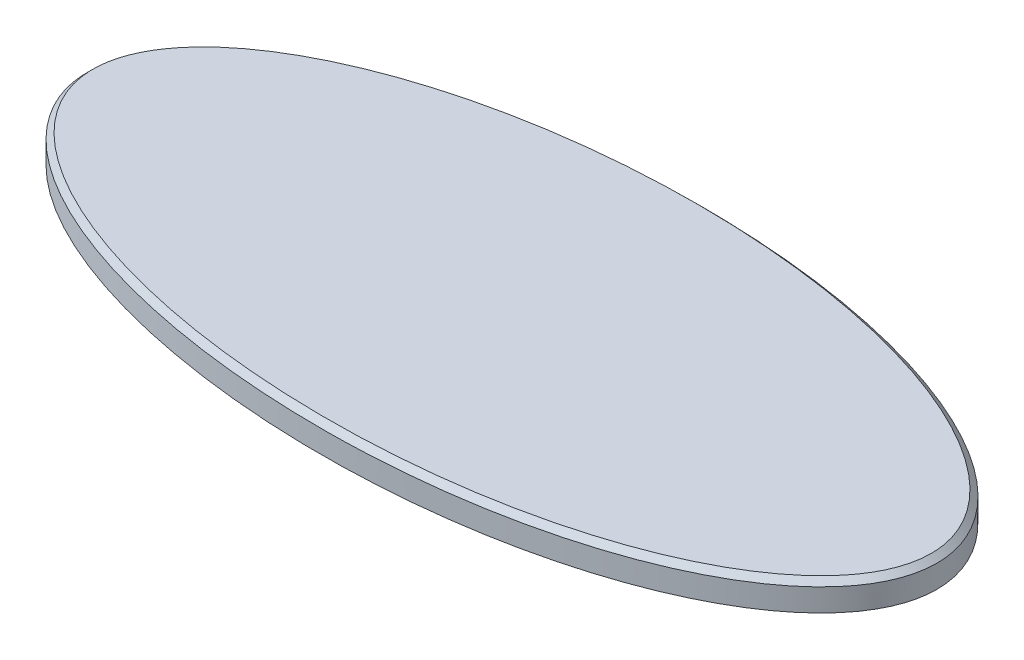
from build123d import *

# Parameters (mm, degrees)
SKETCH1_RX          = 150
SKETCH1_RY          = 67.5
BOSS_EXTRUDE1_DEPTH = 10
CHAMFER1_SIZE       = 2


with BuildPart() as part:
    # Sketch1 → Boss-Extrude1 (new body)
    with BuildSketch(Plane(origin=(0, 0, 0), x_dir=(1, 0, 0), z_dir=(0, 1, 0))):
        with Locations((0, 0)):
            Ellipse(SKETCH1_RX, SKETCH1_RY)
    extrude(amount=BOSS_EXTRUDE1_DEPTH)

    # Chamfer1
    chamfer1_edges = [part.edges().sort_by_distance(p)[0] for p in [
        (-149.992123808, 10, 0.691712462),
    ]]
    chamfer(chamfer1_edges, length=CHAMFER1_SIZE)


solid = part.part
